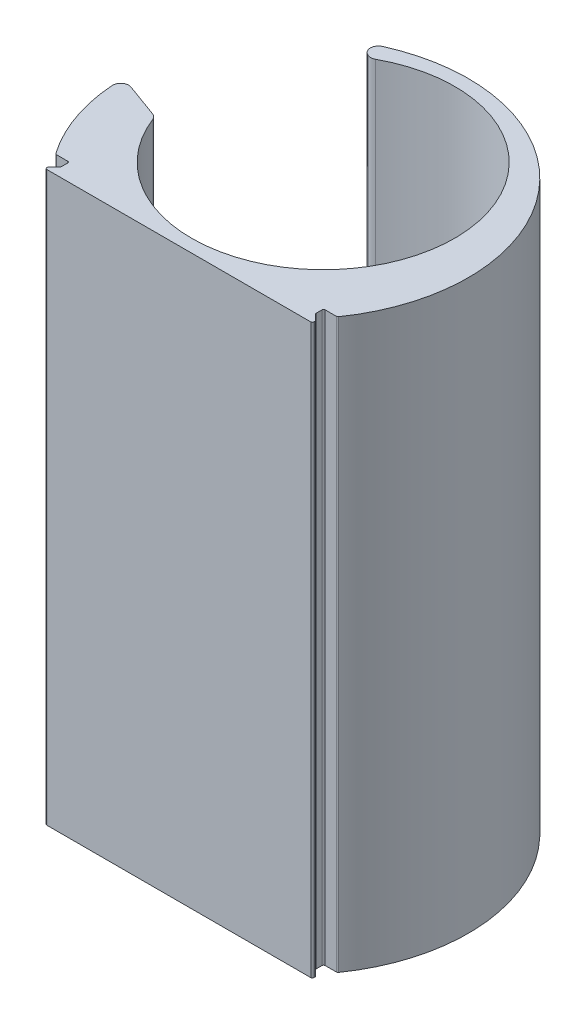
from build123d import *

# Parameters (mm, degrees)
SKETCH1_R           = 16.4
BOSS_EXTRUDE1_DEPTH = 70
BOSS_EXTRUDE2_START = 0.8
BOSS_EXTRUDE2_DEPTH = 0.8
CUT_EXTRUDE1_DEPTH  = 64
FILLET1_R           = 1
FILLET2_R           = 0.2


with BuildPart() as part:
    # Sketch1 → Boss-Extrude1 (new body)
    with BuildSketch(Plane(origin=(0, 0, 0), x_dir=(1, 0, 0), z_dir=(0, 1, 0))):
        with BuildLine():
            Line((-18.386301809, -27.686071188), (-20.098433843, -27.686071188))
            Line((-20.098433843, -27.686071188), (-20.098433843, -28.698203222))
            Line((-20.098433843, -28.698203222), (-19.298433843, -29.498203222))
            Line((-19.298433843, -29.498203222), (-19.298433843, -29.886071188))
            Line((-19.298433843, -29.886071188), (-52.598433843, -29.886071188))
            Line((-52.598433843, -29.886071188), (-52.598433843, -29.498203222))
            Line((-52.598433843, -29.498203222), (-51.798433843, -28.698203222))
            Line((-51.798433843, -28.698203222), (-51.798433843, -27.686071188))
            Line((-51.798433843, -27.686071188), (-53.510565878, -27.686071188))
            ThreePointArc((-53.510565878, -27.686071188), (-35.948433843, 6.216409145), (-18.386301809, -27.686071188))
        make_face()
        with Locations((-35.948433843, -11.886071188)):
            Circle(SKETCH1_R, mode=Mode.SUBTRACT)
    extrude(amount=BOSS_EXTRUDE1_DEPTH)

    # Sketch2 → Boss-Extrude2 (add)
    with BuildSketch(Plane.XZ.offset(BOSS_EXTRUDE2_START)):
        with BuildLine():
            Line((-18.386301809, 27.686071188), (-20.098433843, 27.686071188))
            Line((-20.098433843, 27.686071188), (-20.098433843, 28.698203222))
            Line((-20.098433843, 28.698203222), (-19.298433843, 29.498203222))
            Line((-19.298433843, 29.498203222), (-19.298433843, 29.886071188))
            Line((-19.298433843, 29.886071188), (-52.598433843, 29.886071188))
            Line((-52.598433843, 29.886071188), (-52.598433843, 29.498203222))
            Line((-52.598433843, 29.498203222), (-51.798433843, 28.698203222))
            Line((-51.798433843, 28.698203222), (-51.798433843, 27.686071188))
            Line((-51.798433843, 27.686071188), (-53.510565878, 27.686071188))
            ThreePointArc((-53.510565878, 27.686071188), (-35.948433843, -6.216409145), (-18.386301809, 27.686071188))
        make_face()
    extrude(amount=-BOSS_EXTRUDE2_DEPTH)

    # Sketch3 → Cut-Extrude1 (cut)
    with BuildSketch(Plane(origin=(0, 70, 0), x_dir=(1, 0, 0), z_dir=(0, 1, 0))):
        Polygon((-49.615972348, -18.085360607), (-42.433549338, 1.648184429), (-57.414050135, 7.100640814), (-64.596473145, -12.632904223), align=None)
    extrude(amount=-CUT_EXTRUDE1_DEPTH, mode=Mode.SUBTRACT)

    # Fillet1
    fillet1_edges = [part.edges().sort_by_distance(p)[0] for p in [
        (-57.448378022, 38, 15.234598079),
        (-46.841576343, 38, -3.252575051),
        (-51.377907754, 38, 17.444068565),
        (-44.195484744, 38, -2.289476472),
    ]]
    fillet(fillet1_edges, radius=FILLET1_R)

    # Fillet2
    fillet2_edges = [part.edges().sort_by_distance(p)[0] for p in [
        (-18.386301809, 34.6, 27.686071188),
        (-20.098433843, 34.6, 27.686071188),
        (-20.098433843, 34.6, 28.698203222),
        (-19.298433843, 34.6, 29.498203222),
        (-19.298433843, 34.6, 29.886071188),
        (-52.598433843, 34.6, 29.886071188),
        (-52.598433843, 34.6, 29.498203222),
        (-51.798433843, 34.6, 28.698203222),
        (-51.798433843, 34.6, 27.686071188),
        (-53.510565878, 34.6, 27.686071188),
    ]]
    fillet(fillet2_edges, radius=FILLET2_R)


solid = part.part
